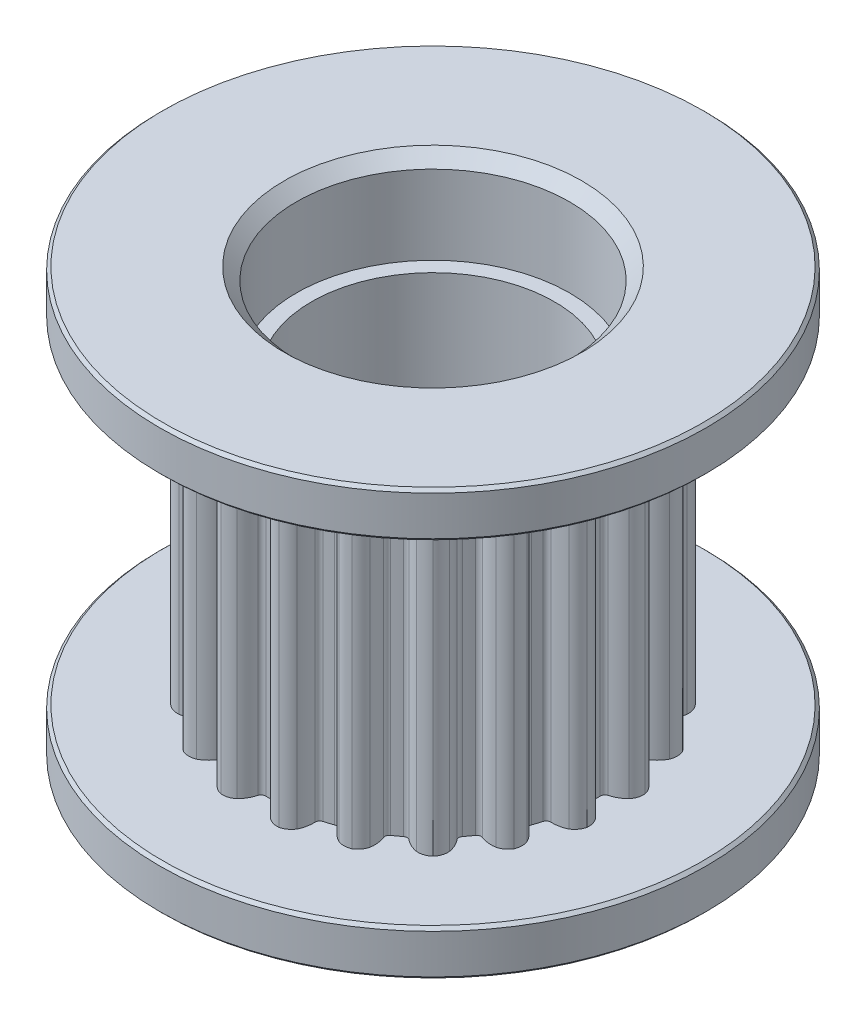
from build123d import *

# Parameters (mm, degrees)
GT2PROFILE_REACH             = 16.526
GT2PROFILE_DIRECTION_2_REACH = 16.526
GT2_GROOVE_CP_COUNT          = 20
INNERC_SIZE                  = 0.4
OUTERC_SIZE                  = 0.1


with BuildPart() as part:
    # BodyS → Body (revolve)
    with BuildSketch(Plane.XY):
        Polygon((6.11, -5.5), (6.11, 5.5), (9, 5.5), (9, 7), (4.5, 7), (4.5, 4), (4, 4), (4, -4), (4.5, -4), (4.5, -7), (9, -7), (9, -5.5), align=None)
    revolve(axis=Axis((0, 7, 0), (0, -1, 0)))

    # GT2Profile: up to this face of the body (flat: up to its plane)
    gt2profile_end = Plane(part.part.faces().sort_by_distance((-8.745441559, -5.5, 0))[0])
    # GT2ProfileS → GT2Profile (cut, up to the picked face)
    with BuildSketch(Plane(origin=(0, 0, 0), x_dir=(1, 0, 0), z_dir=(0, 1, 0)), mode=Mode.PRIVATE) as gt2profile_sk1:
        with BuildLine():
            ThreePointArc((0.299749921, -5.468781955), (0.244461347, -5.387479579), (0.150701934, -5.357881011))
            ThreePointArc((0.150701934, -5.357881011), (0, -5.36), (-0.150701934, -5.357881011))
            ThreePointArc((-0.150701934, -5.357881011), (-0.244461347, -5.387479579), (-0.299749921, -5.468781955))
            ThreePointArc((-0.299749921, -5.468781955), (-0.396626607, -5.703924717), (-0.549685833, -5.907025885))
            ThreePointArc((-0.549685833, -5.907025885), (-0.7593874, -6.016293358), (-0.995541542, -6.028349446))
            ThreePointArc((-0.995541542, -6.028349446), (0, -6.11), (0.995541542, -6.028349446))
            ThreePointArc((0.995541542, -6.028349446), (0.7593874, -6.016293358), (0.549685833, -5.907025885))
            ThreePointArc((0.549685833, -5.907025885), (0.396626607, -5.703924717), (0.299749921, -5.468781955))
        make_face()
    gt2profile_tool1 = split(extrude(gt2profile_sk1.sketch, amount=-GT2PROFILE_REACH, mode=Mode.PRIVATE), bisect_by=gt2profile_end, keep=Keep.BOTH, mode=Mode.PRIVATE)
    gt2profile = gt2profile_tool1.solids().sort_by(Axis((0, 0, 5.802237), (0, -1, 0)))[0]
    add(gt2profile, mode=Mode.SUBTRACT)

    # GT2Profile direction 2: up to this face of the body (flat: up to its plane)
    gt2profile_direction_2_end = Plane(part.part.faces().sort_by_distance((-6.364558441, 5.5, 0))[0])
    # GT2ProfileS → GT2Profile direction 2 (cut, up to the picked face)
    with BuildSketch(Plane(origin=(0, 0, 0), x_dir=(1, 0, 0), z_dir=(0, 1, 0)), mode=Mode.PRIVATE) as gt2profile_direction_2_sk1:
        with BuildLine():
            ThreePointArc((0.299749921, -5.468781955), (0.244461347, -5.387479579), (0.150701934, -5.357881011))
            ThreePointArc((0.150701934, -5.357881011), (0, -5.36), (-0.150701934, -5.357881011))
            ThreePointArc((-0.150701934, -5.357881011), (-0.244461347, -5.387479579), (-0.299749921, -5.468781955))
            ThreePointArc((-0.299749921, -5.468781955), (-0.396626607, -5.703924717), (-0.549685833, -5.907025885))
            ThreePointArc((-0.549685833, -5.907025885), (-0.7593874, -6.016293358), (-0.995541542, -6.028349446))
            ThreePointArc((-0.995541542, -6.028349446), (0, -6.11), (0.995541542, -6.028349446))
            ThreePointArc((0.995541542, -6.028349446), (0.7593874, -6.016293358), (0.549685833, -5.907025885))
            ThreePointArc((0.549685833, -5.907025885), (0.396626607, -5.703924717), (0.299749921, -5.468781955))
        make_face()
    gt2profile_direction_2_tool1 = split(extrude(gt2profile_direction_2_sk1.sketch, amount=GT2PROFILE_DIRECTION_2_REACH, mode=Mode.PRIVATE), bisect_by=gt2profile_direction_2_end, keep=Keep.BOTH, mode=Mode.PRIVATE)
    gt2profile_direction_2 = gt2profile_direction_2_tool1.solids().sort_by(Axis((0, 0, 5.802237), (0, 1, 0)))[0]
    add(gt2profile_direction_2, mode=Mode.SUBTRACT)

    # GT2 Groove CP: GT2Profile, GT2Profile direction 2 ×20 about axis
    gt2_groove_cp_axis = Axis((0, 7, 0), (0, 1, 0))
    add([gt2profile.rotate(gt2_groove_cp_axis, i * 360 / GT2_GROOVE_CP_COUNT) for i in range(1, GT2_GROOVE_CP_COUNT)], mode=Mode.SUBTRACT)
    add([gt2profile_direction_2.rotate(gt2_groove_cp_axis, i * 360 / GT2_GROOVE_CP_COUNT) for i in range(1, GT2_GROOVE_CP_COUNT)], mode=Mode.SUBTRACT)

    # InnerC
    innerc_edges = [part.edges().sort_by_distance(p)[0] for p in [
        (-4.5, -7, 0),
        (-4.5, 7, 0),
    ]]
    chamfer(innerc_edges, length=INNERC_SIZE)

    # OuterC
    outerc_edges = [part.edges().sort_by_distance(p)[0] for p in [
        (-9, -7, 0),
        (-9, -5.5, 0),
        (-9, 5.5, 0),
        (-9, 7, 0),
    ]]
    chamfer(outerc_edges, length=OUTERC_SIZE)


solid = part.part
